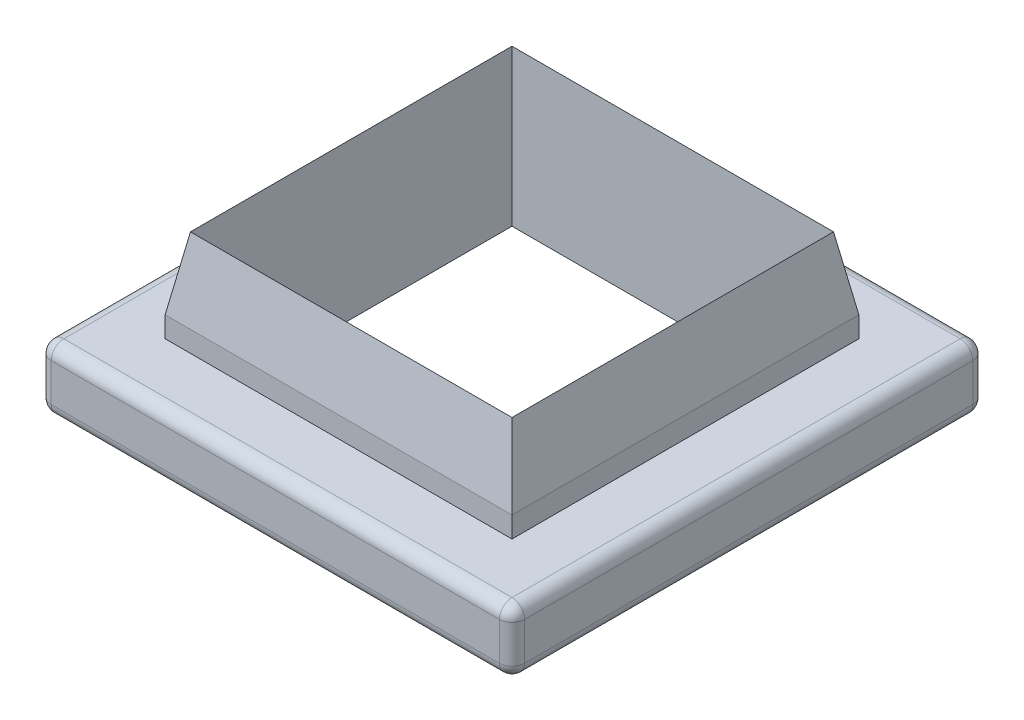
from build123d import *

# Parameters (mm, degrees)
SKETCH1_W           = 27.4
SKETCH1_H           = 27.4
SKETCH1_W_2         = 25.4
SKETCH1_H_2         = 25.4
BOSS_EXTRUDE1_DEPTH = 35
SKETCH1_3_W         = 37.4
SKETCH1_3_H         = 37.4
SKETCH1_3_W_2       = 27.4
SKETCH1_3_H_2       = 27.4
BOSS_EXTRUDE2_DEPTH = 5
CHAMFER1_SIZE       = 5
CHAMFER1_SIZE_2     = 28.356409098
FILLET1_R           = 1


with BuildPart() as part:
    # Sketch1 → Boss-Extrude1 (new body)
    with BuildSketch(Plane(origin=(0, 0, 0), x_dir=(1, 0, 0), z_dir=(0, 1, 0))):
        with Locations((13.7, 13.7)):
            Rectangle(SKETCH1_W, SKETCH1_H)
        with Locations((13.7, 13.7)):
            Rectangle(SKETCH1_W_2, SKETCH1_H_2, mode=Mode.SUBTRACT)
    extrude(amount=BOSS_EXTRUDE1_DEPTH)

    # Sketch1<3> → Boss-Extrude2 (add)
    with BuildSketch(Plane(origin=(0, 0, 0), x_dir=(1, 0, 0), z_dir=(0, 1, 0))):
        with Locations((13.7, 13.7)):
            Rectangle(SKETCH1_3_W, SKETCH1_3_H)
        with Locations((13.7, 13.7)):
            Rectangle(SKETCH1_3_W_2, SKETCH1_3_H_2, mode=Mode.SUBTRACT)
    extrude(amount=BOSS_EXTRUDE2_DEPTH)

    # Chamfer1
    # the kernel refuses this chamfer: 28.356409098, 5 mm, written as the material it takes off along each edge
    with BuildSketch(Plane(origin=(101.085229169, 35, -27.4), x_dir=(0, 0.2101387607674354, 0.9776715712462578), z_dir=(-1, 0, 0)), Plane(origin=(0, 35, -101.085229169), x_dir=(0.9776715712462578, 0.2101387607674354, 0), z_dir=(0, 0, 1))) as chamfer1_piece_1:
        Polygon((CHAMFER1_SIZE * 0.977671571246, -CHAMFER1_SIZE * 0.210138760767), (-CHAMFER1_SIZE_2 * 0.210138760768, -CHAMFER1_SIZE_2 * 0.977671571249), (0, 0), align=None)
    extrude(amount=174.770458337, mode=Mode.SUBTRACT)
    with BuildSketch(Plane(origin=(27.4, 35, 73.685229169), x_dir=(0.006682531656101585, -0.9999776716360547, 0), z_dir=(0, 0, -1)), Plane(origin=(-73.685229169, 35, 0), x_dir=(0, -0.9999776716360547, 0.006682531656101581), z_dir=(1, 0, 0))) as chamfer1_piece_2:
        Polygon((CHAMFER1_SIZE_2 * 0.999977671639, CHAMFER1_SIZE_2 * 0.00668253165612), (-CHAMFER1_SIZE * 0.0066825316561, CHAMFER1_SIZE * 0.999977671636), (0, 0), align=None)
    extrude(amount=174.770458337, mode=Mode.SUBTRACT)

    # Fillet1
    fillet1_edges = [part.edges().sort_by_distance(p)[0] for p in [
        (-5, 5, -13.7),
        (-5, 2.5, -32.4),
        (13.7, 0, 5),
        (-5, 2.5, 5),
        (32.4, 0, -13.7),
        (32.4, 2.5, 5),
        (13.7, 5, -32.4),
        (32.4, 2.5, -32.4),
        (13.7, 5, 5),
        (32.4, 5, -13.7),
        (-5, 0, -13.7),
        (13.7, 0, -32.4),
    ]]
    fillet(fillet1_edges, radius=FILLET1_R)


solid = part.part
